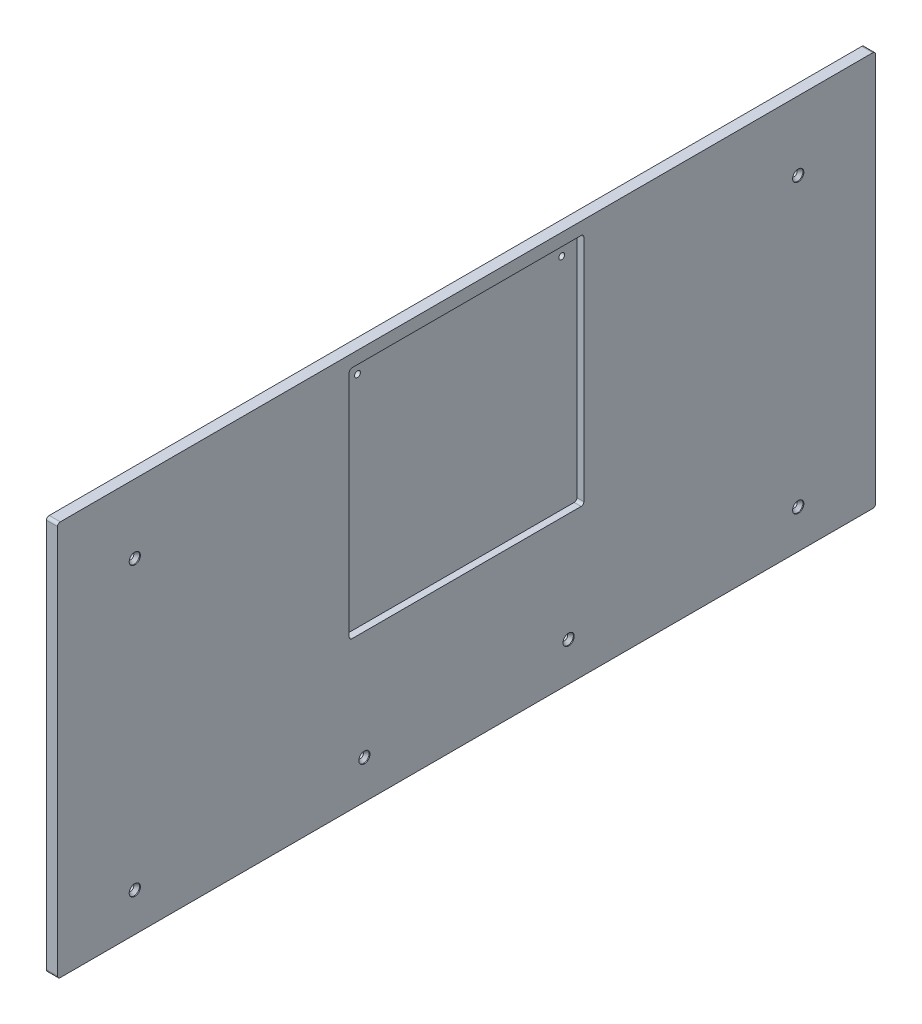
from build123d import *

# Parameters (mm, degrees)
SKETCH1_W                                     = 940.88204
SKETCH1_H                                     = 454.025
SKETCH1_R                                     = 3.3734375
BOSS_EXTRUDE1_DEPTH                           = 12.7
FILLET1_R                                     = 3.175
SKETCH2_W                                     = 269.875
SKETCH2_H                                     = 269.875
CUT_EXTRUDE1_DEPTH                            = 7.9375
FILLET2_R                                     = 3.175
CSK_FOR_1_4_FLAT_HEAD_MACHINE_SCREW1_AT_COUNT = 2
CSK_FOR_1_4_FLAT_HEAD_MACHINE_SCREW1_AT_PITCH = 763.08204
CSK_FOR_1_4_FLAT_HEAD_MACHINE_SCREW1_2_COUNT  = 2
CSK_FOR_1_4_FLAT_HEAD_MACHINE_SCREW1_2_PITCH  = 330.2
CSK_FOR_1_4_FLAT_HEAD_MACHINE_SCREW1_3_COUNT  = 2
CSK_FOR_1_4_FLAT_HEAD_MACHINE_SCREW1_3_PITCH  = 422.803622168
CSK_FOR_1_4_FLAT_HEAD_MACHINE_SCREW1_4_COUNT  = 2
CSK_FOR_1_4_FLAT_HEAD_MACHINE_SCREW1_4_PITCH  = 598.371981477
CSK_FOR_1_4_FLAT_HEAD_MACHINE_SCREW1_5_COUNT  = 2
CSK_FOR_1_4_FLAT_HEAD_MACHINE_SCREW1_5_PITCH  = 831.460305589


with BuildPart() as part:
    # Sketch1 → Boss-Extrude1 (new body)
    with BuildSketch(Plane(origin=(0, 0, 0), x_dir=(0, 0, -1), z_dir=(1, 0, 0))):
        with Locations((470.44102, 227.0125)):
            Rectangle(SKETCH1_W, SKETCH1_H)
        with Locations((352.96602, 422.275)):
            Circle(SKETCH1_R, mode=Mode.SUBTRACT)
        with Locations((587.91602, 422.275)):
            Circle(SKETCH1_R, mode=Mode.SUBTRACT)
    extrude(amount=BOSS_EXTRUDE1_DEPTH)

    # Fillet1
    fillet1_edges = [part.edges().sort_by_distance(p)[0] for p in [
        (6.35, 454.025, -940.88204),
        (6.35, 0, -940.88204),
        (6.35, 0, 0),
        (6.35, 454.025, 0),
    ]]
    fillet(fillet1_edges, radius=FILLET1_R)

    # Sketch2 → Cut-Extrude1 (cut)
    with BuildSketch(Plane(origin=(12.7, 0, 0), x_dir=(0, 0, -1), z_dir=(1, 0, 0))):
        with Locations((470.44102, 304.8)):
            Rectangle(SKETCH2_W, SKETCH2_H)
    extrude(amount=-CUT_EXTRUDE1_DEPTH, mode=Mode.SUBTRACT)

    # Fillet2
    fillet2_edges = [part.edges().sort_by_distance(p)[0] for p in [
        (8.73125, 439.7375, -335.50352),
        (8.73125, 439.7375, -605.37852),
        (8.73125, 169.8625, -335.50352),
        (8.73125, 169.8625, -605.37852),
    ]]
    fillet(fillet2_edges, radius=FILLET2_R)

    # Sketch5 → CSK for 1/4 Flat Head Machine Screw1 (revolve, cut)
    with BuildSketch(Plane(origin=(12.7, 374.65, -88.9), x_dir=(0, 0, -1), z_dir=(0, 1, 0))):
        Polygon((0, 0), (0, 12.7), (3.3782, 12.7), (3.3782, 4.536932584), (6.4389, 1.016), (6.4389, 0), align=None)
    csk_for_1_4_flat_head_machine_screw1 = revolve(axis=Axis((19.05, 374.65, -88.9), (-1, 0, 0)), mode=Mode.SUBTRACT)

    # CSK for 1/4 Flat Head Machine Screw1 at: CSK for 1/4 Flat Head Machine Screw1 ×2
    with Locations(*[(0, 0, -i * CSK_FOR_1_4_FLAT_HEAD_MACHINE_SCREW1_AT_PITCH) for i in range(1, CSK_FOR_1_4_FLAT_HEAD_MACHINE_SCREW1_AT_COUNT)]):
        add(csk_for_1_4_flat_head_machine_screw1, mode=Mode.SUBTRACT)

    # CSK for 1_4 Flat Head Machine Screw1 2: CSK for 1/4 Flat Head Machine Screw1 ×2
    with Locations(*[(0, -i * CSK_FOR_1_4_FLAT_HEAD_MACHINE_SCREW1_2_PITCH, 0) for i in range(1, CSK_FOR_1_4_FLAT_HEAD_MACHINE_SCREW1_2_COUNT)]):
        add(csk_for_1_4_flat_head_machine_screw1, mode=Mode.SUBTRACT)

    # CSK for 1_4 Flat Head Machine Screw1 3: CSK for 1/4 Flat Head Machine Screw1 ×2
    with Locations(*[Vector(0, -0.7809772260384187, -0.6245595026971703) * (i * CSK_FOR_1_4_FLAT_HEAD_MACHINE_SCREW1_3_PITCH) for i in range(1, CSK_FOR_1_4_FLAT_HEAD_MACHINE_SCREW1_3_COUNT)]):
        add(csk_for_1_4_flat_head_machine_screw1, mode=Mode.SUBTRACT)

    # CSK for 1_4 Flat Head Machine Screw1 4: CSK for 1/4 Flat Head Machine Screw1 ×2
    with Locations(*[Vector(0, -0.5518306508686767, -0.833956193550868) * (i * CSK_FOR_1_4_FLAT_HEAD_MACHINE_SCREW1_4_PITCH) for i in range(1, CSK_FOR_1_4_FLAT_HEAD_MACHINE_SCREW1_4_COUNT)]):
        add(csk_for_1_4_flat_head_machine_screw1, mode=Mode.SUBTRACT)

    # CSK for 1_4 Flat Head Machine Screw1 5: CSK for 1/4 Flat Head Machine Screw1 ×2
    with Locations(*[Vector(0, -0.39713260847250104, -0.9177612387150741) * (i * CSK_FOR_1_4_FLAT_HEAD_MACHINE_SCREW1_5_PITCH) for i in range(1, CSK_FOR_1_4_FLAT_HEAD_MACHINE_SCREW1_5_COUNT)]):
        add(csk_for_1_4_flat_head_machine_screw1, mode=Mode.SUBTRACT)


solid = part.part
